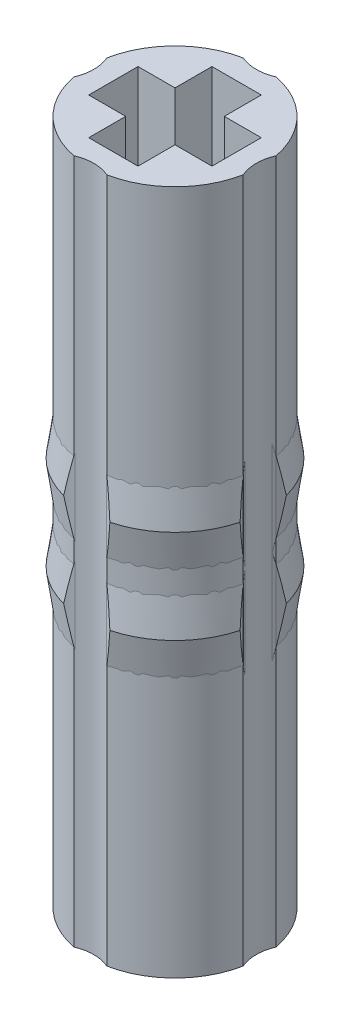
from build123d import *

# Parameters (mm, degrees)
BOSS_EXTRUDE1_DEPTH = 27.8
CUT_EXTRUDE1_START  = 10.0999999
CUT_EXTRUDE1_DEPTH  = 7.6000002


# Read off the part's stored shape, not the designer's step: Cut-Extrude1
with BuildPart() as part:
    # Sketch1 → Boss-Extrude1 (new body)
    with BuildSketch(Plane(origin=(0, 0, 0), x_dir=(1, 0, 0), z_dir=(0, 1, 0))):
        with BuildLine():
            ThreePointArc((3.19363752, 1.43201934), (2.474873734, 2.474873734), (1.43201934, 3.19363752))
            ThreePointArc((1.43201934, 3.19363752), (1.058555912, 3.336084438), (0.671286664, 3.43502172))
            ThreePointArc((0.671286664, 3.43502172), (0, 3.297125136), (-0.671286664, 3.43502172))
            ThreePointArc((-0.671286664, 3.43502172), (-1.058555912, 3.336084438), (-1.43201934, 3.19363752))
            ThreePointArc((-1.43201934, 3.19363752), (-2.474873734, 2.474873734), (-3.19363752, 1.43201934))
            ThreePointArc((-3.19363752, 1.43201934), (-3.336084438, 1.058555912), (-3.43502172, 0.671286664))
            ThreePointArc((-3.43502172, 0.671286664), (-3.331955489, 0.342651883), (-3.297125136, 0))
            ThreePointArc((-3.297125136, 0), (-3.331955489, -0.342651883), (-3.43502172, -0.671286664))
            ThreePointArc((-3.43502172, -0.671286664), (-3.336084438, -1.058555912), (-3.19363752, -1.43201934))
            ThreePointArc((-3.19363752, -1.43201934), (-2.474873734, -2.474873734), (-1.43201934, -3.19363752))
            ThreePointArc((-1.43201934, -3.19363752), (-1.058555912, -3.336084438), (-0.671286664, -3.43502172))
            ThreePointArc((-0.671286664, -3.43502172), (0, -3.297125136), (0.671286664, -3.43502172))
            ThreePointArc((0.671286664, -3.43502172), (1.058555912, -3.336084438), (1.43201934, -3.19363752))
            ThreePointArc((1.43201934, -3.19363752), (2.474873734, -2.474873734), (3.19363752, -1.43201934))
            ThreePointArc((3.19363752, -1.43201934), (3.336084438, -1.058555912), (3.43502172, -0.671286664))
            ThreePointArc((3.43502172, -0.671286664), (3.297125136, 0), (3.43502172, 0.671286664))
            ThreePointArc((3.43502172, 0.671286664), (3.336084438, 1.058555912), (3.19363752, 1.43201934))
        make_face()
        Polygon((1, -1), (1, -2.5), (-1, -2.5), (-1, -1), (-2.5, -1), (-2.5, 1), (-1, 1), (-1, 2.5), (1, 2.5), (1, 1), (2.5, 1), (2.5, -1), align=None, mode=Mode.SUBTRACT)
    extrude(amount=BOSS_EXTRUDE1_DEPTH)


with BuildPart() as body_2:
    # Sketch2 → Revolve4 (revolve)
    with BuildSketch(Plane.XY, mode=Mode.PRIVATE) as revolve4_sk:
        Polygon((3.7, 15.8), (3.436, 17.7), (3.436, 15.8), (3.436, 13.9), align=None)
        Polygon((3.436, 10.1), (3.436, 12), (3.436, 13.9), (3.7, 12), align=None)
    revolve(revolve4_sk.sketch.rotate(Axis((0, 32.061175454, 0), (0, -1, 0)), 90), axis=Axis((0, 32.061175454, 0), (0, -1, 0)))

    # Cut-Extrude1 outline → Cut-Extrude1 (cut)
    with BuildSketch(Plane(origin=(0, 0, 0), x_dir=(1, 0, 0), z_dir=(0, 1, 0)).offset(CUT_EXTRUDE1_START)):
        with BuildLine():
            ThreePointArc((0.556520579, 3.390631289), (0, 6.702874864), (-0.556520579, 3.390631289))
            ThreePointArc((-0.556520579, 3.390631289), (0, 3.436), (0.556520579, 3.390631289))
        make_face()
        with BuildLine():
            ThreePointArc((3.435021543, -0.67128625), (6.702874864, 0), (3.435021543, 0.67128625))
            ThreePointArc((3.435021543, 0.67128625), (3.435511814, 0.668773933), (3.436, 0.66626121))
            ThreePointArc((3.436, 0.66626121), (3.412749609, 0.608798977), (3.391609595, 0.550527297))
            ThreePointArc((3.391609595, 0.550527297), (3.436, 0), (3.391609602, -0.550527298))
            ThreePointArc((3.391609602, -0.550527298), (3.412749609, -0.608798977), (3.436, -0.66626121))
            ThreePointArc((3.436, -0.66626121), (3.435511814, -0.668773933), (3.435021543, -0.67128625))
        make_face()
        with BuildLine():
            ThreePointArc((-3.391609614, -0.550527225), (-3.436, 0), (-3.391609614, 0.550527225))
            ThreePointArc((-3.391609614, 0.550527225), (-6.7, 0), (-3.391609614, -0.550527225))
        make_face()
        with BuildLine():
            ThreePointArc((0.556520586, -3.390631333), (0, -3.436), (-0.556520586, -3.390631333))
            ThreePointArc((-0.556520586, -3.390631333), (0, -6.702874864), (0.556520586, -3.390631333))
        make_face()
    extrude(amount=CUT_EXTRUDE1_DEPTH, mode=Mode.SUBTRACT)


solid = Compound([part.part, body_2.part])
